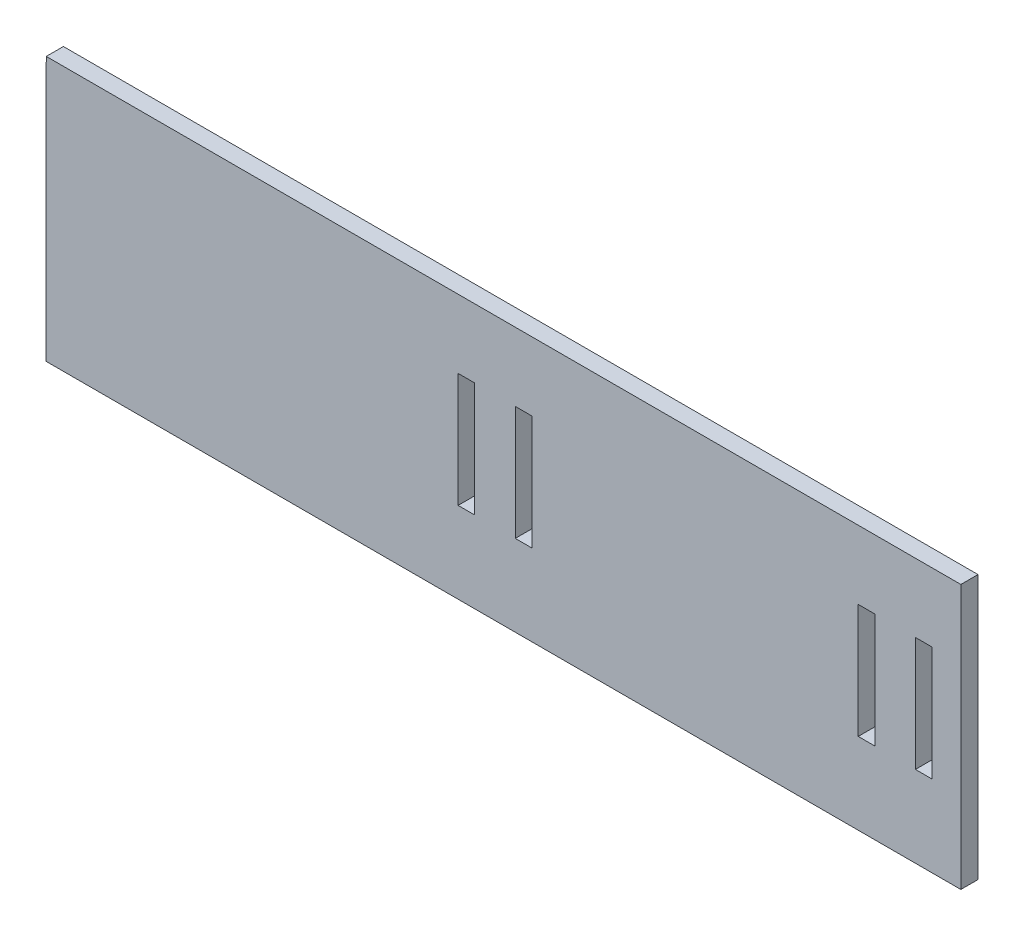
from build123d import *

# Parameters (mm, degrees)
BOSS_EXTRUDE1_DEPTH = 3
SKETCH4_W           = 2.9
SKETCH4_H           = 20
CUT_EXTRUDE1_DEPTH  = 131.070008293


with BuildPart() as part:
    # Sketch3 → Boss-Extrude1 (new body)
    with BuildSketch(Plane(origin=(0, 0, 0), x_dir=(0.9999995359140308, -0.000963416692323297, 0), z_dir=(0, 0, 1))):
        Polygon((87.907726379, 95.819824151), (-72.092273621, 95.665677408), (-72.092273621, 49.448943998), (87.95225233, 49.603133638), align=None)
    extrude(amount=BOSS_EXTRUDE1_DEPTH)

    # Sketch4 → Cut-Extrude1 (cut, through all)
    with BuildSketch(Plane.XY.offset(3)):
        with Locations((1.5, 73.735087911)):
            Rectangle(SKETCH4_W, SKETCH4_H)
        with Locations((11.5, 73.735087911)):
            Rectangle(SKETCH4_W, SKETCH4_H)
        with Locations((71.5, 73.735087911)):
            Rectangle(SKETCH4_W, SKETCH4_H)
        with Locations((81.5, 73.735087911)):
            Rectangle(SKETCH4_W, SKETCH4_H)
    extrude(amount=-CUT_EXTRUDE1_DEPTH, mode=Mode.SUBTRACT)


solid = part.part
